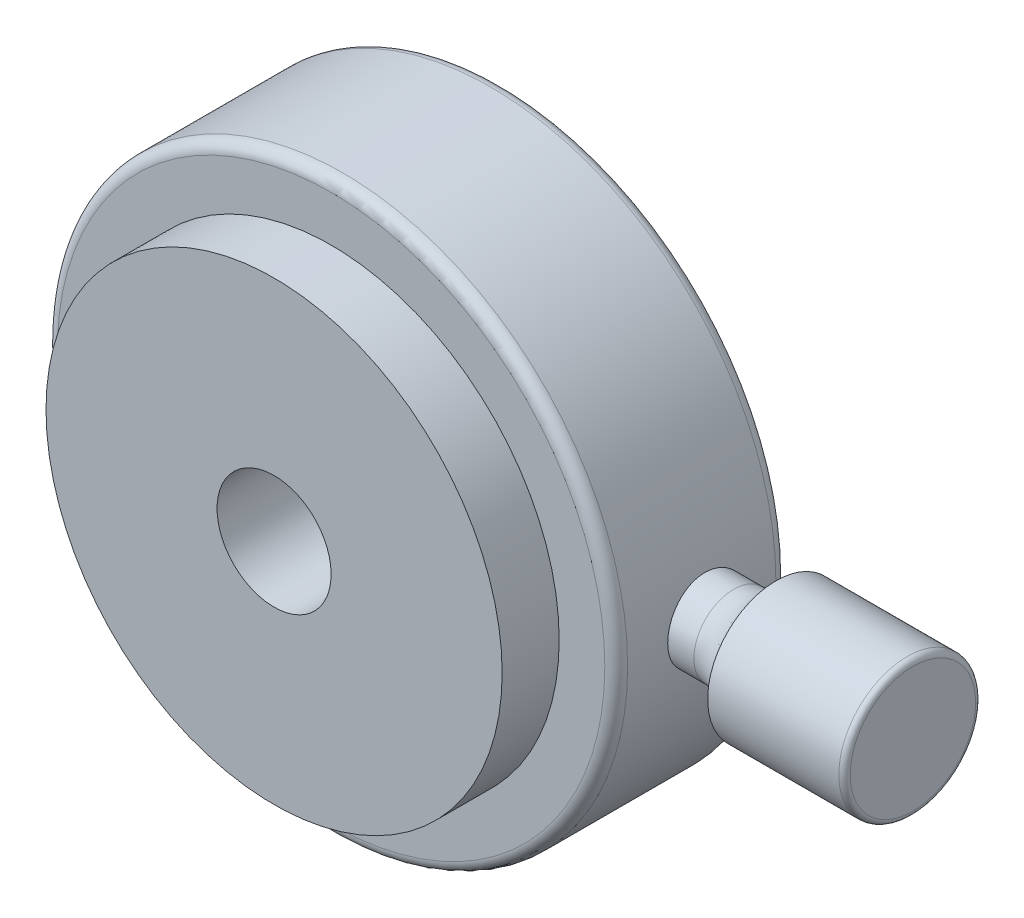
from build123d import *

# Parameters (mm, degrees)
SKETCH_1_R          = 25
EXTRUDE_1_DEPTH     = 20
SKETCH_2_R          = 5
CUT_EXTRUDE_1_DEPTH = 10
SKETCH_3_R          = 10
CUT_EXTRUDE_2_DEPTH = 5
CUT_EXTRUDE_START   = -5
SKETCH_4_R          = 25
CUT_EXTRUDE_3_DEPTH = 5
EXTRUDE_START       = 5
SKETCH_5_R          = 20
SKETCH_5_R_2        = 5
EXTRUDE_2_DEPTH     = 5
SKETCH_6_R          = 3.5
EXTRUDE_3_DEPTH     = 7
SKETCH_7_R          = 6
EXTRUDE_4_DEPTH     = 12
FILLET_1_R          = 4
FILLET_2_R          = 0.5
FILLET_3_R          = 1
FILLET_4_R          = 1


with BuildPart() as part:
    # 草图1 → 凸台-拉伸1 (new body)
    with BuildSketch(Plane.XY):
        Circle(SKETCH_1_R)
    extrude(amount=EXTRUDE_1_DEPTH)

    # 草图2 → 切除-拉伸1 (cut)
    with BuildSketch(Plane.XY.offset(20)):
        Circle(SKETCH_2_R)
    extrude(amount=-CUT_EXTRUDE_1_DEPTH, mode=Mode.SUBTRACT)

    # 草图3 → 切除-拉伸2 (cut)
    with BuildSketch(Plane.XY.offset(10)):
        Circle(SKETCH_3_R)
    extrude(amount=-CUT_EXTRUDE_2_DEPTH, mode=Mode.SUBTRACT)

    # 草图4 → 切除-拉伸3 (cut)
    with BuildSketch(Plane.XY.offset(20).offset(CUT_EXTRUDE_START)):
        Circle(SKETCH_4_R)
    extrude(amount=CUT_EXTRUDE_3_DEPTH, mode=Mode.SUBTRACT)

    # 草图5 → 凸台-拉伸2 (add)
    with BuildSketch(Plane.XY.offset(15).offset(EXTRUDE_START)):
        Circle(SKETCH_5_R)
        Circle(SKETCH_5_R_2, mode=Mode.SUBTRACT)
    extrude(amount=-EXTRUDE_2_DEPTH)

    # 草图6 → 凸台-拉伸3 (add)
    with BuildSketch(Plane(origin=(24, 0, 0), x_dir=(0, 0, -1), z_dir=(1, 0, 0))):
        with Locations((-6.983226233, 0)):
            Circle(SKETCH_6_R)
    extrude(amount=EXTRUDE_3_DEPTH)

    # 草图7 → 凸台-拉伸4 (add)
    with BuildSketch(Plane(origin=(31, 0, 0), x_dir=(0, 0, -1), z_dir=(1, 0, 0))):
        with Locations((-6.983226233, 0)):
            Circle(SKETCH_7_R)
    extrude(amount=EXTRUDE_4_DEPTH)

    # 圆角1
    # the kernel refuses this fillet: 4 mm, written as the material it adds along each edge
    with BuildSketch(Plane(origin=(31, 0, 6.983226233), x_dir=(0, 0, -1), z_dir=(0, -1, 0))) as fillet_1_piece_1:
        with BuildLine():
            CenterArc((7.5, -3.708099244), FILLET_1_R, 112.024312837, 67.975687163)
            Line((3.5, -3.708099244), (3.42, -3.708099244))
            Line((3.42, -3.708099244), (3.42, 0))
            Line((3.42, 0), (3.5, 0.08))
            ThreePointArc((3.5, 0.08), (4.75, 0.08), (5.97, 0.074161985))
            Line((5.97, 0.074161985), (6, 0))
        make_face()
    revolve(axis=Axis((31, 0, 6.983226233), (1, 0, 0)))

    # 圆角2
    fillet_2_edges = [part.edges().sort_by_distance(p)[0] for p in [
        (43, 0, 12.983226233),
    ]]
    fillet(fillet_2_edges, radius=FILLET_2_R)

    # 圆角3
    fillet_3_edges = [part.edges().sort_by_distance(p)[0] for p in [
        (-25, 0, 0),
    ]]
    fillet(fillet_3_edges, radius=FILLET_3_R)

    # 圆角4
    fillet_4_edges = [part.edges().sort_by_distance(p)[0] for p in [
        (-25, 0, 15),
    ]]
    fillet(fillet_4_edges, radius=FILLET_4_R)


solid = part.part
